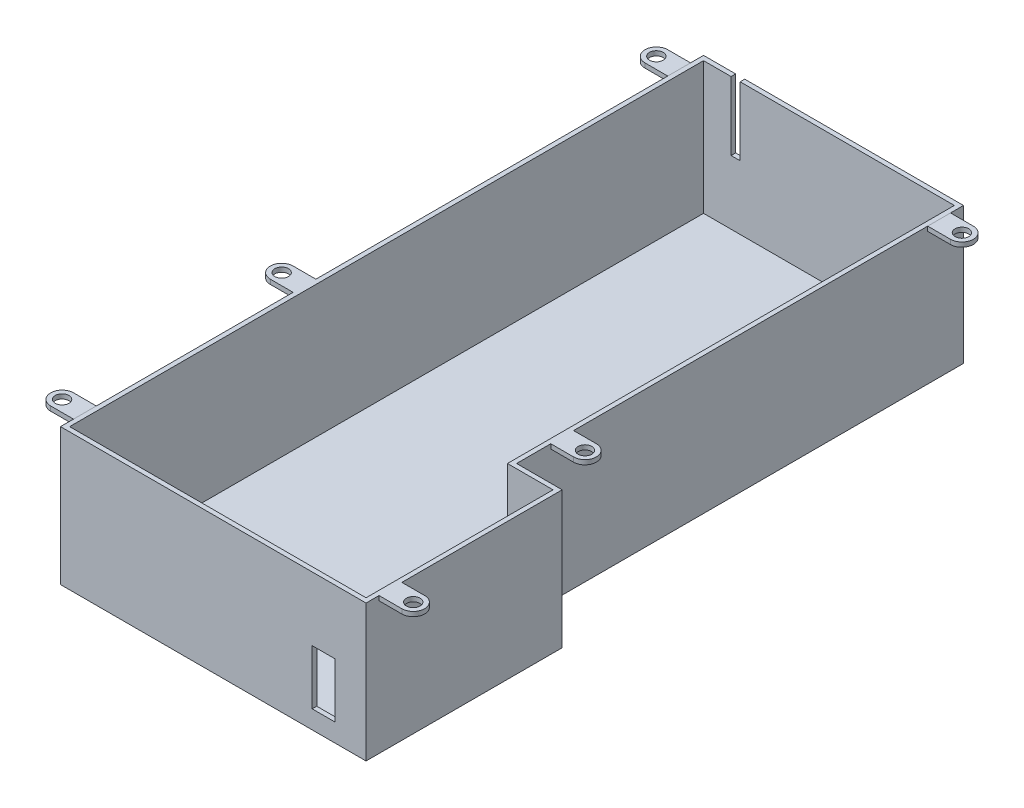
from build123d import *

# Parameters (mm, degrees)
SKETCH2_W             = 57
SKETCH2_H             = 141
BOSS_EXTRUDE1_DEPTH   = 30
SKETCH3_R             = 1.5
BOSS_EXTRUDE3_DEPTH   = 1
BOSS_EXTRUDE3_2_DEPTH = 1
BOSS_EXTRUDE3_3_DEPTH = 1
SKETCH4_W             = 43
SKETCH4_H             = 30
BOSS_EXTRUDE4_DEPTH   = 10
MIRROR1_START         = 29
MIRROR1_OUTLINE_R     = 1.5
MIRROR1_DEPTH         = 1
SHELL3_START          = -27.5
SHELL3_OUTLINE_W      = 29
SHELL3_OUTLINE_H      = 139
SHELL3_DEPTH          = 55
SHELL3_START_2        = 27.5
SHELL3_2_OUTLINE_W    = 29
SHELL3_2_OUTLINE_H    = 41
SHELL3_2_DEPTH        = 10
SKETCH7_W             = 5
SKETCH7_H             = 12
CUT_EXTRUDE1_DEPTH    = 19
SKETCH8_W             = 2
SKETCH8_H             = 15
CUT_EXTRUDE2_DEPTH    = 19
SKETCH10_R            = 1.5
BOSS_EXTRUDE5_DEPTH   = 1
SKETCH11_R            = 1.5
BOSS_EXTRUDE6_DEPTH   = 1


# Read off the part's stored shape, not the designer's step: Mirror1, Shell3
with BuildPart() as part:
    # Sketch2 → Boss-Extrude1 (new body)
    with BuildSketch(Plane(origin=(0, 0, 0), x_dir=(1, 0, 0), z_dir=(0, 1, 0))):
        Rectangle(SKETCH2_W, SKETCH2_H)
    extrude(amount=BOSS_EXTRUDE1_DEPTH)

    # Sketch4 → Boss-Extrude4 (add)
    with BuildSketch(Plane(origin=(28.5, 0, 0), x_dir=(0, 0, -1), z_dir=(1, 0, 0))):
        with Locations((-49, 15)):
            Rectangle(SKETCH4_W, SKETCH4_H)
    extrude(amount=BOSS_EXTRUDE4_DEPTH)

    # Mirror1 outline → Mirror1 (add)
    with BuildSketch(Plane(origin=(0, 0, 0), x_dir=(1, 0, 0), z_dir=(0, 1, 0)).offset(MIRROR1_START)):
        with BuildLine():
            ThreePointArc((43.5, -67.652604127), (46, -65.152604127), (43.5, -62.652604127))
            Line((43.5, -62.652604127), (38.5, -62.652604127))
            Line((38.5, -62.652604127), (38.5, -67.652604127))
            Line((38.5, -67.652604127), (43.5, -67.652604127))
        make_face()
        with Locations((43.5, -65.152604127)):
            Circle(MIRROR1_OUTLINE_R, mode=Mode.SUBTRACT)
    extrude(amount=MIRROR1_DEPTH)

    # Shell3 outline → Shell3 (cut)
    with BuildSketch(Plane.YZ.offset(SHELL3_START)):
        with Locations((15.5, 0)):
            Rectangle(SHELL3_OUTLINE_W, SHELL3_OUTLINE_H)
    extrude(amount=SHELL3_DEPTH, mode=Mode.SUBTRACT)

    # Shell3 2 outline → Shell3 2 (cut)
    with BuildSketch(Plane.YZ.offset(SHELL3_START_2)):
        with Locations((15.5, 49)):
            Rectangle(SHELL3_2_OUTLINE_W, SHELL3_2_OUTLINE_H)
    extrude(amount=SHELL3_2_DEPTH, mode=Mode.SUBTRACT)

    # Sketch7 → Cut-Extrude1 (cut)
    with BuildSketch(Plane.XY.offset(70.5)):
        with Locations((29.189674396, 10)):
            Rectangle(SKETCH7_W, SKETCH7_H)
    extrude(amount=-CUT_EXTRUDE1_DEPTH, mode=Mode.SUBTRACT)

    # Sketch8 → Cut-Extrude2 (cut)
    with BuildSketch(Plane(origin=(0, 0, -70.5), x_dir=(-1, 0, 0), z_dir=(0, 0, -1))):
        with Locations((20.463026601, 22.5)):
            Rectangle(SKETCH8_W, SKETCH8_H)
    extrude(amount=-CUT_EXTRUDE2_DEPTH, mode=Mode.SUBTRACT)

    # Sketch10 → Boss-Extrude5 (add)
    with BuildSketch(Plane(origin=(0, 30, 0), x_dir=(1, 0, 0), z_dir=(0, 1, 0))):
        with BuildLine():
            Line((33.5, -15), (28.5, -15))
            Line((28.5, -15), (28.5, -20))
            Line((28.5, -20), (33.5, -20))
            ThreePointArc((33.5, -20), (36, -17.5), (33.5, -15))
        make_face()
        with Locations(Location((33.5, -17.5, 0), (0, 0, 270))):
            Circle(SKETCH10_R, mode=Mode.SUBTRACT)
    extrude(amount=-BOSS_EXTRUDE5_DEPTH)

    # Sketch11 → Boss-Extrude6 (add)
    with BuildSketch(Plane(origin=(0, 30, 0), x_dir=(1, 0, 0), z_dir=(0, 1, 0))):
        with BuildLine():
            Line((-28.5, -19.5), (-33.5, -19.5))
            ThreePointArc((-33.5, -19.5), (-36, -17), (-33.5, -14.5))
            Line((-33.5, -14.5), (-28.5, -14.5))
            Line((-28.5, -14.5), (-28.5, -19.5))
        make_face()
        with Locations(Location((-33.5, -17, 0), (0, 0, 90))):
            Circle(SKETCH11_R, mode=Mode.SUBTRACT)
    extrude(amount=-BOSS_EXTRUDE6_DEPTH)


with BuildPart() as body_2:
    # Sketch3 → Boss-Extrude3 (new body)
    with BuildSketch(Plane(origin=(0, 30, 0), x_dir=(1, 0, 0), z_dir=(0, 1, 0))):
        with BuildLine():
            Line((-33.5, 67.652604127), (-28.5, 67.652604127))
            Line((-28.5, 67.652604127), (-28.5, 62.652604127))
            Line((-28.5, 62.652604127), (-33.5, 62.652604127))
            ThreePointArc((-33.5, 62.652604127), (-36, 65.152604127), (-33.5, 67.652604127))
        make_face()
        with Locations(Location((-33.5, 65.152604127, 0), (0, 0, 270))):
            Circle(SKETCH3_R, mode=Mode.SUBTRACT)
    extrude(amount=-BOSS_EXTRUDE3_DEPTH)


with BuildPart() as body_3:
    # Sketch3 → Boss-Extrude3 2 (new body)
    with BuildSketch(Plane(origin=(0, 30, 0), x_dir=(1, 0, 0), z_dir=(0, 1, 0))):
        with BuildLine():
            Line((-28.5, -67.652604127), (-28.5, -62.652604127))
            Line((-28.5, -62.652604127), (-33.5, -62.652604127))
            ThreePointArc((-33.5, -62.652604127), (-36, -65.152604127), (-33.5, -67.652604127))
            Line((-33.5, -67.652604127), (-28.5, -67.652604127))
        make_face()
        with Locations(Location((-33.5, -65.152604127, 0), (0, 0, 90))):
            Circle(SKETCH3_R, mode=Mode.SUBTRACT)
    extrude(amount=-BOSS_EXTRUDE3_2_DEPTH)


with BuildPart() as body_4:
    # Sketch3 → Boss-Extrude3 3 (new body)
    with BuildSketch(Plane(origin=(0, 30, 0), x_dir=(1, 0, 0), z_dir=(0, 1, 0))):
        with BuildLine():
            Line((28.5, 67.652604127), (28.5, 62.652604127))
            Line((28.5, 62.652604127), (33.5, 62.652604127))
            ThreePointArc((33.5, 62.652604127), (36, 65.152604127), (33.5, 67.652604127))
            Line((33.5, 67.652604127), (28.5, 67.652604127))
        make_face()
        with Locations(Location((33.5, 65.152604127, 0), (0, 0, 90))):
            Circle(SKETCH3_R, mode=Mode.SUBTRACT)
    extrude(amount=-BOSS_EXTRUDE3_3_DEPTH)


solid = Compound([part.part, body_2.part, body_3.part, body_4.part])
